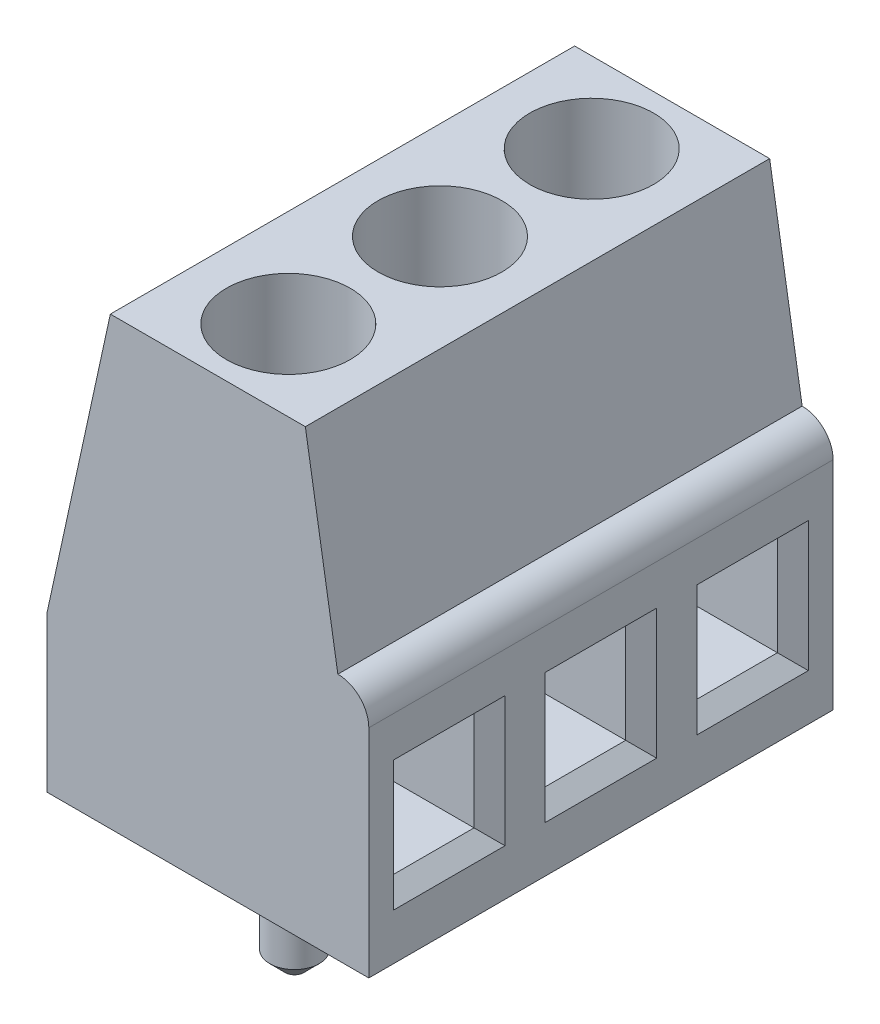
from build123d import *

# Parameters (mm, degrees)
RESSALTO_EXTRUS_O1_DEPTH = 15
ESBO_O2_W                = 2.6
ESBO_O2_H                = 3.2
CORTE_EXTRUS_O1_DEPTH    = 5
CHANFRO1_SIZE            = 0.5
ESBO_O3_R                = 0.8
RESSALTO_EXTRUS_O2_DEPTH = 3.5
CHANFRO3_SIZE            = 0.5
ESBO_O4_R                = 2
CORTE_EXTRUS_O2_DEPTH    = 3


with BuildPart() as part:
    # Esboço1 → Ressalto-extrusão1 (new body)
    with BuildSketch(Plane.XY):
        with BuildLine():
            Line((-10.4, -8.689473684), (0, -8.689473684))
            Line((0, -8.689473684), (0, -1.689473684))
            ThreePointArc((0, -1.689473684), (-0.292893219, -0.982366903), (-1, -0.689473684))
            Line((-1, -0.689473684), (-2.05, 5.710526316))
            Line((-2.05, 5.710526316), (-8.35, 5.710526316))
            Line((-8.35, 5.710526316), (-10.4, -3.689473684))
            Line((-10.4, -3.689473684), (-10.4, -8.689473684))
        make_face()
    extrude(amount=RESSALTO_EXTRUS_O1_DEPTH)

    # Esboço2 → Corte-extrusão1 (cut)
    with BuildSketch(Plane(origin=(0, 0, 0), x_dir=(0, 0, -1), z_dir=(1, 0, 0))):
        with Locations((-12.4, -5.089473684)):
            Rectangle(ESBO_O2_W, ESBO_O2_H)
        with Locations((-7.5, -5.089473684)):
            Rectangle(ESBO_O2_W, ESBO_O2_H)
        with Locations((-2.6, -5.089473684)):
            Rectangle(ESBO_O2_W, ESBO_O2_H)
    extrude(amount=-CORTE_EXTRUS_O1_DEPTH, mode=Mode.SUBTRACT)

    # Chanfro1
    chanfro1_edges = [part.edges().sort_by_distance(p)[0] for p in [
        (0, -6.689473684, 2.6),
        (0, -5.089473684, 1.3),
        (0, -3.489473684, 2.6),
        (0, -5.089473684, 3.9),
        (0, -6.689473684, 7.5),
        (0, -5.089473684, 6.2),
        (0, -3.489473684, 7.5),
        (0, -5.089473684, 8.8),
        (0, -6.689473684, 12.4),
        (0, -5.089473684, 13.7),
        (0, -5.089473684, 11.1),
        (0, -3.489473684, 12.4),
    ]]
    chamfer(chanfro1_edges, length=CHANFRO1_SIZE)

    # Esboço3 → Ressalto-extrusão2 (add)
    with BuildSketch(Plane(origin=(0, -8.689473684, 0), x_dir=(-1, 0, 0), z_dir=(0, -1, 0))):
        with Locations((5, -12.4)):
            Circle(ESBO_O3_R)
        with Locations((5, -7.5)):
            Circle(ESBO_O3_R)
        with Locations((5, -2.6)):
            Circle(ESBO_O3_R)
    extrude(amount=RESSALTO_EXTRUS_O2_DEPTH)

    # Chanfro3
    chanfro3_edges = [part.edges().sort_by_distance(p)[0] for p in [
        (-4.2, -12.189473684, 2.6),
        (-4.2, -12.189473684, 7.5),
        (-4.2, -12.189473684, 12.4),
    ]]
    chamfer(chanfro3_edges, length=CHANFRO3_SIZE)

    # Esboço4 → Corte-extrusão2 (cut)
    with BuildSketch(Plane(origin=(0, 5.710526316, 0), x_dir=(1, 0, 0), z_dir=(0, 1, 0))):
        with Locations((-5.2, -12.4)):
            Circle(ESBO_O4_R)
        with Locations((-5.2, -7.5)):
            Circle(ESBO_O4_R)
        with Locations((-5.2, -2.6)):
            Circle(ESBO_O4_R)
    extrude(amount=-CORTE_EXTRUS_O2_DEPTH, mode=Mode.SUBTRACT)


solid = part.part
